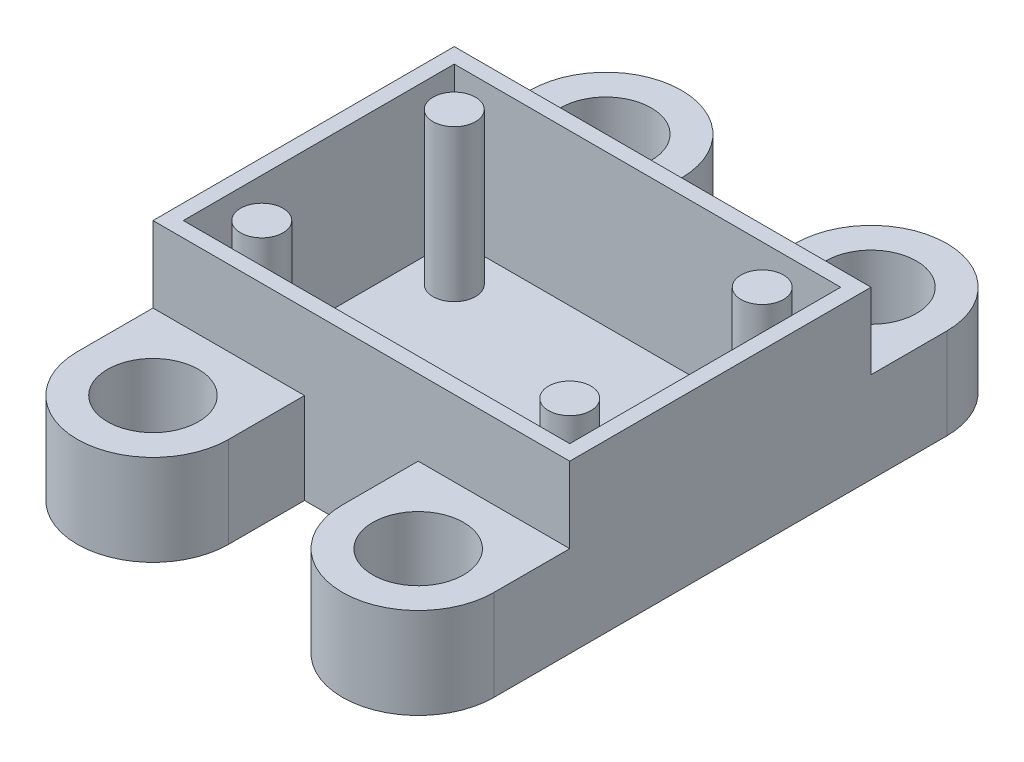
from build123d import *

# Parameters (mm, degrees)
SKETCH1_W           = 27.5
SKETCH1_H           = 19.88
SKETCH1_W_2         = 25.5
SKETCH1_H_2         = 17.88
BOSS_EXTRUDE1_DEPTH = 10
SKETCH3_W           = 27.5
SKETCH3_H           = 19.88
BOSS_EXTRUDE2_DEPTH = 1
SKETCH4_R           = 1.4
BOSS_EXTRUDE3_DEPTH = 10
SKETCH12_R          = 3
BOSS_EXTRUDE6_DEPTH = 6


with BuildPart() as part:
    # Sketch1 → Boss-Extrude1 (new body)
    with BuildSketch(Plane(origin=(0, 0, 0), x_dir=(1, 0, 0), z_dir=(0, 1, 0))):
        Rectangle(SKETCH1_W, SKETCH1_H)
        Rectangle(SKETCH1_W_2, SKETCH1_H_2, mode=Mode.SUBTRACT)
    extrude(amount=BOSS_EXTRUDE1_DEPTH)

    # Sketch3 → Boss-Extrude2 (add)
    with BuildSketch(Plane(origin=(0, 0, 0), x_dir=(1, 0, 0), z_dir=(0, 1, 0))):
        Rectangle(SKETCH3_W, SKETCH3_H)
    extrude(amount=-BOSS_EXTRUDE2_DEPTH)

    # Sketch4 → Boss-Extrude3 (add)
    with BuildSketch(Plane(origin=(0, 0, 0), x_dir=(1, 0, 0), z_dir=(0, 1, 0))):
        with Locations((-10.16, 6.35)):
            Circle(SKETCH4_R)
        with Locations((10.16, 6.35)):
            Circle(SKETCH4_R)
        with Locations((-10.16, -6.35)):
            Circle(SKETCH4_R)
        with Locations((10.16, -6.35)):
            Circle(SKETCH4_R)
    extrude(amount=BOSS_EXTRUDE3_DEPTH)

    # Sketch12 → Boss-Extrude6 (add)
    # profile 1 of 4: a face of its own
    with BuildSketch(Plane(origin=(40.87798925, -1, 20.164210109), x_dir=(-1, 0, 0), z_dir=(0, -1, 0))):
        with BuildLine():
            Line((27.12798925, 35.104210109), (27.12798925, 30.104210109))
            Line((27.12798925, 30.104210109), (37.12798925, 30.104210109))
            Line((37.12798925, 30.104210109), (37.12798925, 35.104210109))
            ThreePointArc((37.12798925, 35.104210109), (32.12798925, 40.104210109), (27.12798925, 35.104210109))
        make_face()
        with Locations((32.12798925, 35.104210109)):
            Circle(SKETCH12_R, mode=Mode.SUBTRACT)
    # profile 2 of 4: a face of its own
    with BuildSketch(Plane(origin=(40.87798925, -1, 20.164210109), x_dir=(-1, 0, 0), z_dir=(0, -1, 0))):
        with BuildLine():
            Line((37.12798925, 5.224210109), (37.12798925, 10.224210109))
            Line((37.12798925, 10.224210109), (27.12798925, 10.224210109))
            Line((27.12798925, 10.224210109), (27.12798925, 5.224210109))
            ThreePointArc((27.12798925, 5.224210109), (32.12798925, 0.224210109), (37.12798925, 5.224210109))
        make_face()
        with Locations((32.12798925, 5.224210109)):
            Circle(SKETCH12_R, mode=Mode.SUBTRACT)
    # profile 3 of 4: a face of its own
    with BuildSketch(Plane(origin=(40.87798925, -1, 20.164210109), x_dir=(-1, 0, 0), z_dir=(0, -1, 0))):
        with BuildLine():
            Line((54.62798925, 5.224210109), (54.62798925, 10.224210109))
            Line((54.62798925, 10.224210109), (44.62798925, 10.224210109))
            Line((44.62798925, 10.224210109), (44.62798925, 5.224210109))
            ThreePointArc((44.62798925, 5.224210109), (49.62798925, 0.224210109), (54.62798925, 5.224210109))
        make_face()
        with Locations((49.62798925, 5.224210109)):
            Circle(SKETCH12_R, mode=Mode.SUBTRACT)
    # profile 4 of 4: a face of its own
    with BuildSketch(Plane(origin=(40.87798925, -1, 20.164210109), x_dir=(-1, 0, 0), z_dir=(0, -1, 0))):
        with BuildLine():
            Line((44.62798925, 35.104210109), (44.62798925, 30.104210109))
            Line((44.62798925, 30.104210109), (54.62798925, 30.104210109))
            Line((54.62798925, 30.104210109), (54.62798925, 35.104210109))
            ThreePointArc((54.62798925, 35.104210109), (49.62798925, 40.104210109), (44.62798925, 35.104210109))
        make_face()
        with Locations((49.62798925, 35.104210109)):
            Circle(SKETCH12_R, mode=Mode.SUBTRACT)
    extrude(amount=-BOSS_EXTRUDE6_DEPTH)


solid = part.part
